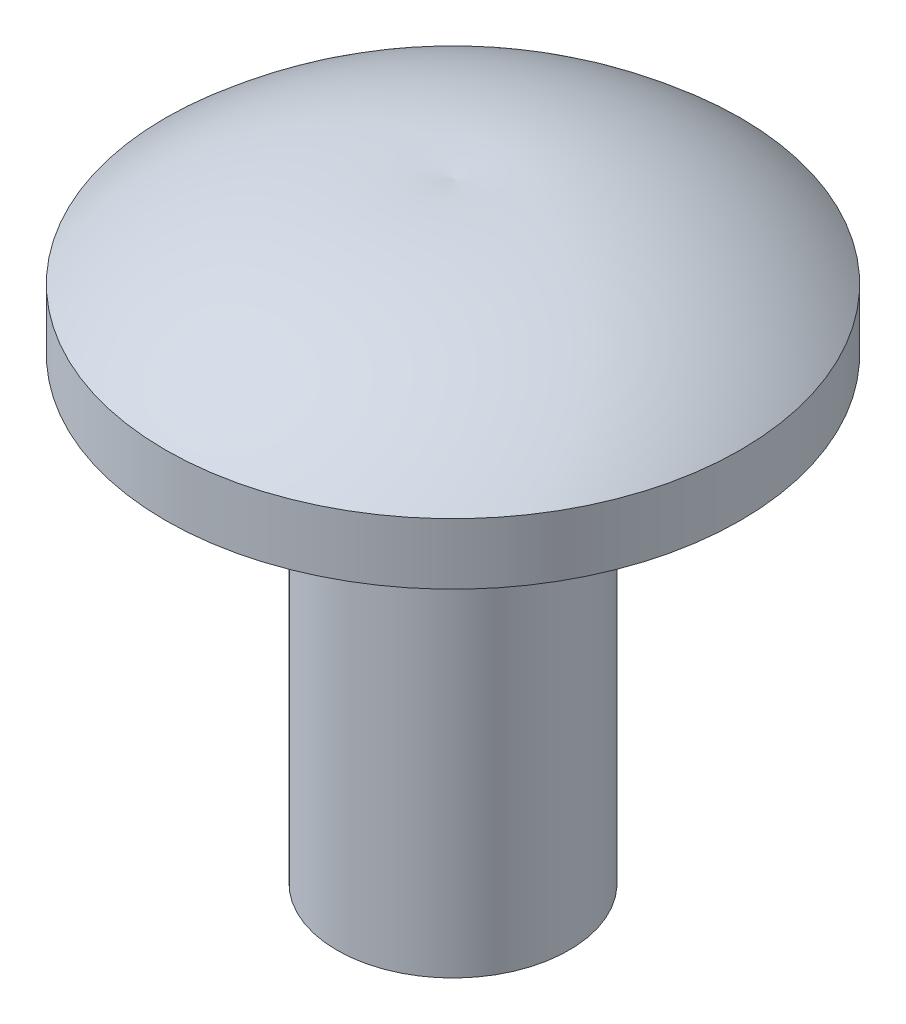
from build123d import *


with BuildPart() as part:
    # Sketch1 → Revolve1 (revolve)
    with BuildSketch(Plane.XY):
        with BuildLine():
            Line((0, 0), (2.413, 0))
            Line((2.413, 0), (2.413, 9.525))
            Line((2.413, 9.525), (5.980230191, 9.525))
            Line((5.980230191, 9.525), (5.980230191, 10.795))
            ThreePointArc((5.980230191, 10.795), (3.192398953, 12.382515239), (0, 12.7))
            Line((0, 12.7), (0, 0))
        make_face()
    revolve(axis=Axis((0, 0, 0), (0, 1, 0)))


solid = part.part
